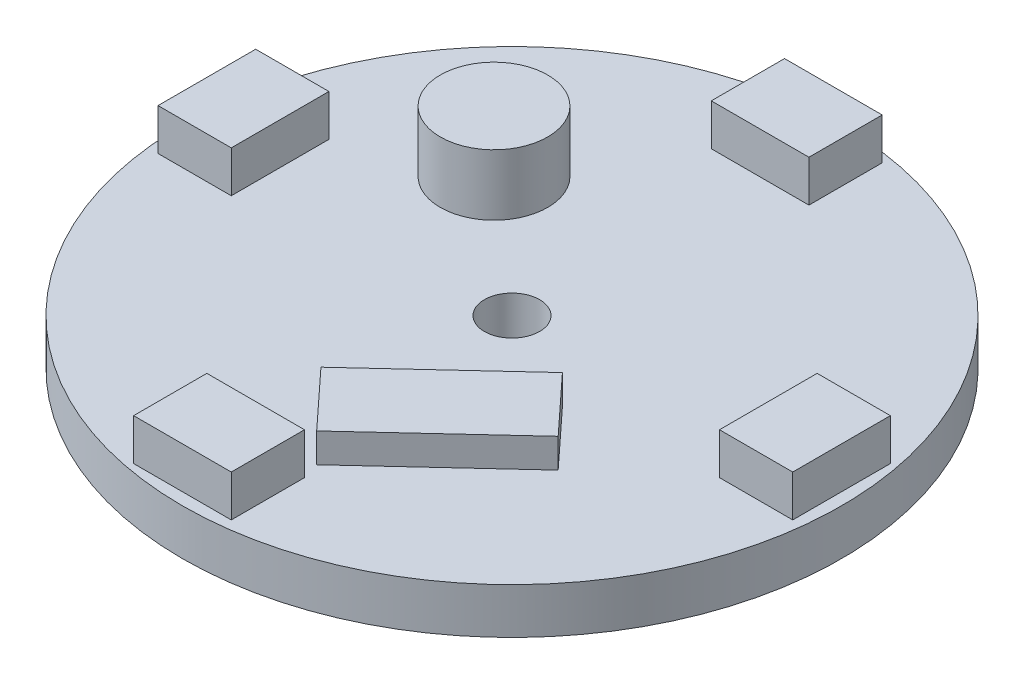
from build123d import *

# Parameters (mm, degrees)
SKETCH1_R           = 17.145
SKETCH1_R_2         = 1.436229084
BOSS_EXTRUDE1_DEPTH = 2.38125
SKETCH3_R           = 2.794
BOSS_EXTRUDE2_DEPTH = 3.175
BOSS_EXTRUDE3_DEPTH = 1.524
SKETCH5_W           = 5.08
SKETCH5_H           = 3.81
SKETCH5_W_2         = 3.81
SKETCH5_H_2         = 5.08
BOSS_EXTRUDE4_DEPTH = 2.159


with BuildPart() as part:
    # Sketch1 → Boss-Extrude1 (new body)
    with BuildSketch(Plane(origin=(0, 0, 0), x_dir=(1, 0, 0), z_dir=(0, 1, 0))):
        with Locations((-9.270876778, 8.817912865)):
            Circle(SKETCH1_R)
        with Locations((-9.270876778, 8.817912865)):
            Circle(SKETCH1_R_2, mode=Mode.SUBTRACT)
    extrude(amount=BOSS_EXTRUDE1_DEPTH)

    # Sketch3 → Boss-Extrude2 (add)
    with BuildSketch(Plane(origin=(0, 2.38125, 0), x_dir=(1, 0, 0), z_dir=(0, 1, 0))):
        with Locations((-16.007627964, 14.618626912)):
            Circle(SKETCH3_R)
    extrude(amount=BOSS_EXTRUDE2_DEPTH)

    # Sketch4 → Boss-Extrude3 (add)
    with BuildSketch(Plane(origin=(0, 2.38125, 0), x_dir=(1, 0, 0), z_dir=(0, 1, 0))):
        Polygon((-10.391608677, -0.001160783), (-3.867194412, 6.037391899), (-1.106713185, 3.054802521), (-7.63112745, -2.983750162), (-10.046548523, -0.373984456), align=None)
    extrude(amount=BOSS_EXTRUDE3_DEPTH)

    # Sketch5 → Boss-Extrude4 (add)
    with BuildSketch(Plane(origin=(0, 2.38125, 0), x_dir=(1, 0, 0), z_dir=(0, 1, 0))):
        with Locations((-9.905876778, -5.787087135)):
            Rectangle(SKETCH5_W, SKETCH5_H)
        with Locations((-9.062799481, 23.422912865)):
            Rectangle(SKETCH5_W, SKETCH5_H)
        with Locations((-23.875876778, 9.452912865)):
            Rectangle(SKETCH5_W_2, SKETCH5_H_2)
        with Locations((5.334123222, 9.452912865)):
            Rectangle(SKETCH5_W_2, SKETCH5_H_2)
    extrude(amount=BOSS_EXTRUDE4_DEPTH)


solid = part.part
